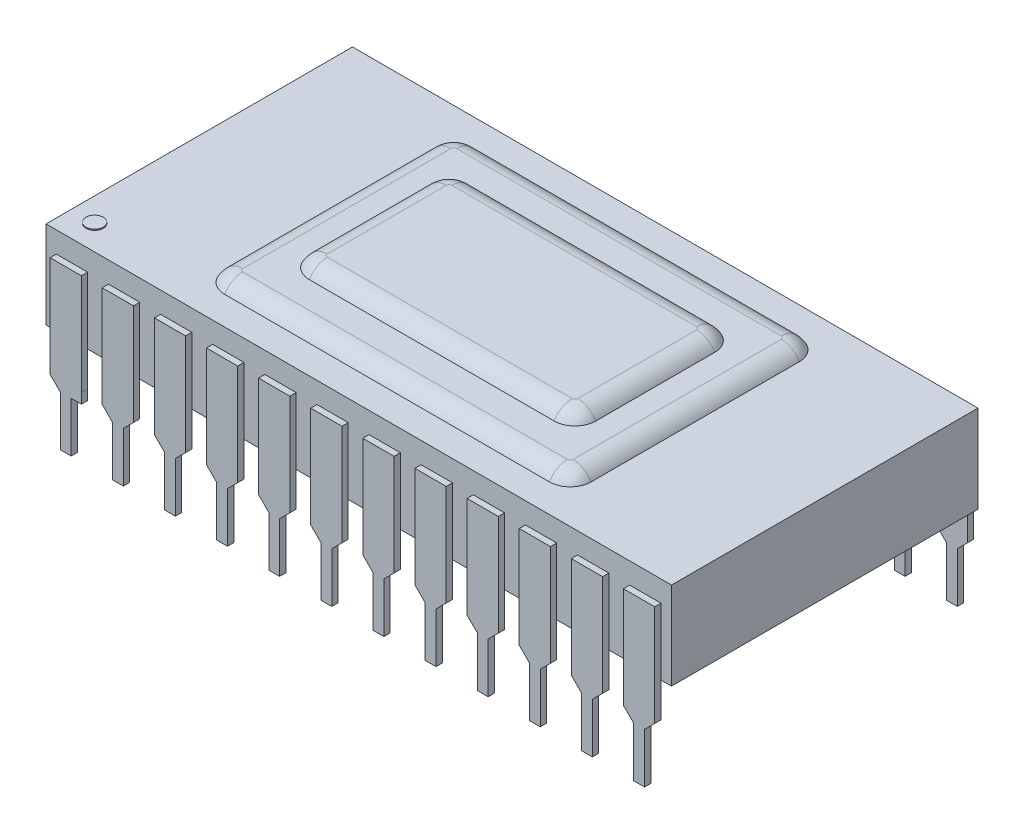
from build123d import *

# Parameters (mm, degrees)
SKETCH_1_W      = 30
SKETCH_1_H      = 7.35
EXTRUDE_1_DEPTH = 4.2
EXTRUDE_2_DEPTH = 0.3
EXTRUDE_3_DEPTH = 0.5
EXTRUDE_4_DEPTH = 0.5
FILLET_1_R      = 1
SKETCH_7_R      = 0.4143812
EXTRUDE_5_DEPTH = 0.05
FILLET_2_R      = 1


with BuildPart() as part:
    # Эскиз1 → Бобышка-Вытянуть1 (new body)
    with BuildSketch(Plane(origin=(0, 0, 0), x_dir=(1, 0, 0), z_dir=(0, 1, 0))):
        with Locations((15, -3.675)):
            Rectangle(SKETCH_1_W, SKETCH_1_H)
    extrude_1 = extrude(amount=EXTRUDE_1_DEPTH)

    # Эскиз3 → Бобышка-Вытянуть2 (add)
    with BuildSketch(Plane.XY.offset(7.35)):
        Polygon((1.995273899, 3.194257325), (1.995273899, -1.651924919), (1.993618963, -1.653579856), (1.993618963, -2.141924919), (1.505273899, -2.141924919), (1.505273899, -4.538244788), (0.985273899, -4.538244788), (0.985273899, -2.141924919), (0.495273899, -1.651924919), (0.495273899, 3.194257325), align=None)
        Polygon((2.995273899, -1.651924919), (3.485273899, -2.141924919), (3.485273899, -4.538244788), (4.005273899, -4.538244788), (4.005273899, -2.141924919), (4.495273899, -1.651924919), (4.495273899, 3.194257325), (2.995273899, 3.194257325), align=None)
        Polygon((5.495273899, -1.651924919), (5.985273899, -2.141924919), (5.985273899, -4.538244788), (6.505273899, -4.538244788), (6.505273899, -2.141924919), (6.995273899, -1.651924919), (6.995273899, 3.194257325), (5.495273899, 3.194257325), align=None)
        Polygon((7.995273899, -1.651924919), (8.485273899, -2.141924919), (8.485273899, -4.538244788), (9.005273899, -4.538244788), (9.005273899, -2.141924919), (9.495273899, -1.651924919), (9.495273899, 3.194257325), (7.995273899, 3.194257325), align=None)
        Polygon((10.495273899, -1.651924919), (10.985273899, -2.141924919), (10.985273899, -4.538244788), (11.505273899, -4.538244788), (11.505273899, -2.141924919), (11.995273899, -1.651924919), (11.995273899, 3.194257325), (10.495273899, 3.194257325), align=None)
        Polygon((12.995273899, -1.651924919), (13.485273899, -2.141924919), (13.485273899, -4.538244788), (14.005273899, -4.538244788), (14.005273899, -2.141924919), (14.495273899, -1.651924919), (14.495273899, 3.194257325), (12.995273899, 3.194257325), align=None)
        Polygon((15.495273899, -1.651924919), (15.985273899, -2.141924919), (15.985273899, -4.538244788), (16.505273899, -4.538244788), (16.505273899, -2.141924919), (16.995273899, -1.651924919), (16.995273899, 3.194257325), (15.495273899, 3.194257325), align=None)
        Polygon((17.995273899, -1.651924919), (18.485273899, -2.141924919), (18.485273899, -4.538244788), (19.005273899, -4.538244788), (19.005273899, -2.141924919), (19.495273899, -1.651924919), (19.495273899, 3.194257325), (17.995273899, 3.194257325), align=None)
        Polygon((20.495273899, -1.651924919), (20.985273899, -2.141924919), (20.985273899, -4.538244788), (21.505273899, -4.538244788), (21.505273899, -2.141924919), (21.995273899, -1.651924919), (21.995273899, 3.194257325), (20.495273899, 3.194257325), align=None)
        Polygon((22.995273899, -1.651924919), (23.485273899, -2.141924919), (23.485273899, -4.538244788), (24.005273899, -4.538244788), (24.005273899, -2.141924919), (24.495273899, -1.651924919), (24.495273899, 3.194257325), (22.995273899, 3.194257325), align=None)
        Polygon((25.495273899, -1.651924919), (25.985273899, -2.141924919), (25.985273899, -4.538244788), (26.505273899, -4.538244788), (26.505273899, -2.141924919), (26.995273899, -1.651924919), (26.995273899, 3.194257325), (25.495273899, 3.194257325), align=None)
        Polygon((27.995273899, -1.651924919), (28.485273899, -2.141924919), (28.485273899, -4.538244788), (29.005273899, -4.538244788), (29.005273899, -2.141924919), (29.495273899, -1.651924919), (29.495273899, 3.194257325), (27.995273899, 3.194257325), align=None)
    extrude_2 = extrude(amount=EXTRUDE_2_DEPTH)

    # Зеркальное отражение1: Бобышка-Вытянуть1, Бобышка-Вытянуть2 across Front Plane
    add(extrude_1.mirror(Plane.XY))
    add(extrude_2.mirror(Plane.XY))

    # Эскиз4 → Бобышка-Вытянуть3 (add)
    with BuildSketch(Plane(origin=(0, 4.2, 0), x_dir=(1, 0, 0), z_dir=(0, 1, 0))):
        with BuildLine():
            Line((7.210589836, 5.992779657), (22.789410164, 5.992779657))
            ThreePointArc((22.789410164, 5.992779657), (23.496516945, 5.699886439), (23.789410164, 4.992779657))
            Line((23.789410164, 4.992779657), (23.789410164, -4.992779657))
            ThreePointArc((23.789410164, -4.992779657), (23.496516945, -5.699886439), (22.789410164, -5.992779657))
            Line((22.789410164, -5.992779657), (7.210589836, -5.992779657))
            ThreePointArc((7.210589836, -5.992779657), (6.503483055, -5.699886439), (6.210589836, -4.992779657))
            Line((6.210589836, -4.992779657), (6.210589836, 4.992779657))
            ThreePointArc((6.210589836, 4.992779657), (6.503483055, 5.699886439), (7.210589836, 5.992779657))
        make_face()
    extrude(amount=EXTRUDE_3_DEPTH)

    # Эскиз5 → Бобышка-Вытянуть4 (add)
    with BuildSketch(Plane(origin=(0, 4.7, 0), x_dir=(1, 0, 0), z_dir=(0, 1, 0))):
        with BuildLine():
            Line((9.128279326, 3.851359726), (20.871720674, 3.851359726))
            ThreePointArc((20.871720674, 3.851359726), (21.578827455, 3.558466508), (21.871720674, 2.851359726))
            Line((21.871720674, 2.851359726), (21.871720674, -2.851359726))
            ThreePointArc((21.871720674, -2.851359726), (21.578827455, -3.558466508), (20.871720674, -3.851359726))
            Line((20.871720674, -3.851359726), (9.128279326, -3.851359726))
            ThreePointArc((9.128279326, -3.851359726), (8.421172545, -3.558466508), (8.128279326, -2.851359726))
            Line((8.128279326, -2.851359726), (8.128279326, 2.851359726))
            ThreePointArc((8.128279326, 2.851359726), (8.421172545, 3.558466508), (9.128279326, 3.851359726))
        make_face()
    extrude(amount=EXTRUDE_4_DEPTH)

    # Скругление1
    # the kernel refuses this fillet: 1 mm, written as the material it takes off along each edge
    with BuildSketch(Plane(origin=(9.128279326, 5.2, 2.851359726), x_dir=(0, 0, 1), z_dir=(1, 0, 0))) as fillet_1_piece_1:
        with BuildLine():
            CenterArc((0.133974596, 1), FILLET_1_R, 270, 60)
            Line((0.133974596, 0), (0.133974596, -0.02))
            Line((0.133974596, -0.02), (1, -0.02))
            Line((1, -0.02), (1.02, 0))
            ThreePointArc((1.02, 0), (1.02, 0.25), (1.017320508, 0.49))
            Line((1.017320508, 0.49), (1, 0.5))
        make_face()
    revolve(axis=Axis((9.128279326, 5.2, 2.851359726), (0, -1, 0)), revolution_arc=90, mode=Mode.SUBTRACT)
    with BuildSketch(Plane(origin=(8.128279326, 5.2, 2.851359726), x_dir=(0, -1, 0), z_dir=(0, 0, -1)), Plane(origin=(21.871720674, 5.2, -2.851359726), x_dir=(0, -1, 0), z_dir=(0, 0, 1))) as fillet_1_piece_2:
        with BuildLine():
            CenterArc((1, -0.866025404), FILLET_1_R, 120, 60)
            Line((0, -0.866025404), (-0.02, -0.866025404))
            Line((-0.02, -0.866025404), (-0.02, 0))
            Line((-0.02, 0), (0, 0.02))
            ThreePointArc((0, 0.02), (0.25, 0.02), (0.49, 0.017320508))
            Line((0.49, 0.017320508), (0.5, 0))
        make_face()
    extrude(amount=5.702719453, mode=Mode.SUBTRACT)
    with BuildSketch(Plane(origin=(9.128279326, 5.2, -2.851359726), x_dir=(-1, 0, 0), z_dir=(0, 0, 1))) as fillet_1_piece_3:
        with BuildLine():
            CenterArc((0.133974596, 1), FILLET_1_R, 270, 60)
            Line((0.133974596, 0), (0.133974596, -0.02))
            Line((0.133974596, -0.02), (1, -0.02))
            Line((1, -0.02), (1.02, 0))
            ThreePointArc((1.02, 0), (1.02, 0.25), (1.017320508, 0.49))
            Line((1.017320508, 0.49), (1, 0.5))
        make_face()
    revolve(axis=Axis((9.128279326, 5.2, -2.851359726), (0, -1, 0)), revolution_arc=90, mode=Mode.SUBTRACT)
    with BuildSketch(Plane(origin=(9.128279326, 5.2, -3.851359726), x_dir=(0, -1, 0), z_dir=(1, 0, 0)), Plane(origin=(20.871720674, 5.2, 3.851359726), x_dir=(0, -1, 0), z_dir=(-1, 0, 0))) as fillet_1_piece_4:
        with BuildLine():
            CenterArc((1, -0.866025404), FILLET_1_R, 120, 60)
            Line((0, -0.866025404), (-0.02, -0.866025404))
            Line((-0.02, -0.866025404), (-0.02, 0))
            Line((-0.02, 0), (0, 0.02))
            ThreePointArc((0, 0.02), (0.25, 0.02), (0.49, 0.017320508))
            Line((0.49, 0.017320508), (0.5, 0))
        make_face()
    extrude(amount=11.743441348, mode=Mode.SUBTRACT)
    with BuildSketch(Plane(origin=(20.871720674, 5.2, -2.851359726), x_dir=(0, 0, -1), z_dir=(-1, 0, 0))) as fillet_1_piece_5:
        with BuildLine():
            CenterArc((0.133974596, 1), FILLET_1_R, 270, 60)
            Line((0.133974596, 0), (0.133974596, -0.02))
            Line((0.133974596, -0.02), (1, -0.02))
            Line((1, -0.02), (1.02, 0))
            ThreePointArc((1.02, 0), (1.02, 0.25), (1.017320508, 0.49))
            Line((1.017320508, 0.49), (1, 0.5))
        make_face()
    revolve(axis=Axis((20.871720674, 5.2, -2.851359726), (0, -1, 0)), revolution_arc=90, mode=Mode.SUBTRACT)
    with BuildSketch(Plane(origin=(20.871720674, 5.2, 2.851359726), x_dir=(1, 0, 0), z_dir=(0, 0, -1))) as fillet_1_piece_6:
        with BuildLine():
            CenterArc((0.133974596, 1), FILLET_1_R, 270, 60)
            Line((0.133974596, 0), (0.133974596, -0.02))
            Line((0.133974596, -0.02), (1, -0.02))
            Line((1, -0.02), (1.02, 0))
            ThreePointArc((1.02, 0), (1.02, 0.25), (1.017320508, 0.49))
            Line((1.017320508, 0.49), (1, 0.5))
        make_face()
    revolve(axis=Axis((20.871720674, 5.2, 2.851359726), (0, -1, 0)), revolution_arc=90, mode=Mode.SUBTRACT)

    # Эскиз7 → Бобышка-Вытянуть5 (add)
    with BuildSketch(Plane(origin=(0, 4.2, 0), x_dir=(1, 0, 0), z_dir=(0, 1, 0))):
        with Locations(Location((1.143207223, -6.162274424, 0), (0, 0, 270))):
            Circle(SKETCH_7_R)
    extrude(amount=EXTRUDE_5_DEPTH)

    # Скругление2
    # the kernel refuses this fillet: 1 mm, written as the material it takes off along each edge
    with BuildSketch(Plane(origin=(7.210589836, 4.7, 4.992779657), x_dir=(0, 0, 1), z_dir=(1, 0, 0))) as fillet_2_piece_1:
        with BuildLine():
            CenterArc((0.133974596, 1), FILLET_2_R, 270, 60)
            Line((0.133974596, 0), (0.133974596, -0.02))
            Line((0.133974596, -0.02), (1, -0.02))
            Line((1, -0.02), (1.02, 0))
            ThreePointArc((1.02, 0), (1.02, 0.25), (1.017320508, 0.49))
            Line((1.017320508, 0.49), (1, 0.5))
        make_face()
    revolve(axis=Axis((7.210589836, 4.7, 4.992779657), (0, -1, 0)), revolution_arc=90, mode=Mode.SUBTRACT)
    with BuildSketch(Plane(origin=(6.210589836, 4.7, 4.992779657), x_dir=(0, -1, 0), z_dir=(0, 0, -1)), Plane(origin=(23.789410164, 4.7, -4.992779657), x_dir=(0, -1, 0), z_dir=(0, 0, 1))) as fillet_2_piece_2:
        with BuildLine():
            CenterArc((1, -0.866025404), FILLET_2_R, 120, 60)
            Line((0, -0.866025404), (-0.02, -0.866025404))
            Line((-0.02, -0.866025404), (-0.02, 0))
            Line((-0.02, 0), (0, 0.02))
            ThreePointArc((0, 0.02), (0.25, 0.02), (0.49, 0.017320508))
            Line((0.49, 0.017320508), (0.5, 0))
        make_face()
    extrude(amount=9.985559315, mode=Mode.SUBTRACT)
    with BuildSketch(Plane(origin=(7.210589836, 4.7, -4.992779657), x_dir=(-1, 0, 0), z_dir=(0, 0, 1))) as fillet_2_piece_3:
        with BuildLine():
            CenterArc((0.133974596, 1), FILLET_2_R, 270, 60)
            Line((0.133974596, 0), (0.133974596, -0.02))
            Line((0.133974596, -0.02), (1, -0.02))
            Line((1, -0.02), (1.02, 0))
            ThreePointArc((1.02, 0), (1.02, 0.25), (1.017320508, 0.49))
            Line((1.017320508, 0.49), (1, 0.5))
        make_face()
    revolve(axis=Axis((7.210589836, 4.7, -4.992779657), (0, -1, 0)), revolution_arc=90, mode=Mode.SUBTRACT)
    with BuildSketch(Plane(origin=(7.210589836, 4.7, -5.992779657), x_dir=(0, -1, 0), z_dir=(1, 0, 0)), Plane(origin=(22.789410164, 4.7, 5.992779657), x_dir=(0, -1, 0), z_dir=(-1, 0, 0))) as fillet_2_piece_4:
        with BuildLine():
            CenterArc((1, -0.866025404), FILLET_2_R, 120, 60)
            Line((0, -0.866025404), (-0.02, -0.866025404))
            Line((-0.02, -0.866025404), (-0.02, 0))
            Line((-0.02, 0), (0, 0.02))
            ThreePointArc((0, 0.02), (0.25, 0.02), (0.49, 0.017320508))
            Line((0.49, 0.017320508), (0.5, 0))
        make_face()
    extrude(amount=15.578820328, mode=Mode.SUBTRACT)
    with BuildSketch(Plane(origin=(22.789410164, 4.7, -4.992779657), x_dir=(0, 0, -1), z_dir=(-1, 0, 0))) as fillet_2_piece_5:
        with BuildLine():
            CenterArc((0.133974596, 1), FILLET_2_R, 270, 60)
            Line((0.133974596, 0), (0.133974596, -0.02))
            Line((0.133974596, -0.02), (1, -0.02))
            Line((1, -0.02), (1.02, 0))
            ThreePointArc((1.02, 0), (1.02, 0.25), (1.017320508, 0.49))
            Line((1.017320508, 0.49), (1, 0.5))
        make_face()
    revolve(axis=Axis((22.789410164, 4.7, -4.992779657), (0, -1, 0)), revolution_arc=90, mode=Mode.SUBTRACT)
    with BuildSketch(Plane(origin=(22.789410164, 4.7, 4.992779657), x_dir=(1, 0, 0), z_dir=(0, 0, -1))) as fillet_2_piece_6:
        with BuildLine():
            CenterArc((0.133974596, 1), FILLET_2_R, 270, 60)
            Line((0.133974596, 0), (0.133974596, -0.02))
            Line((0.133974596, -0.02), (1, -0.02))
            Line((1, -0.02), (1.02, 0))
            ThreePointArc((1.02, 0), (1.02, 0.25), (1.017320508, 0.49))
            Line((1.017320508, 0.49), (1, 0.5))
        make_face()
    revolve(axis=Axis((22.789410164, 4.7, 4.992779657), (0, -1, 0)), revolution_arc=90, mode=Mode.SUBTRACT)


solid = part.part
